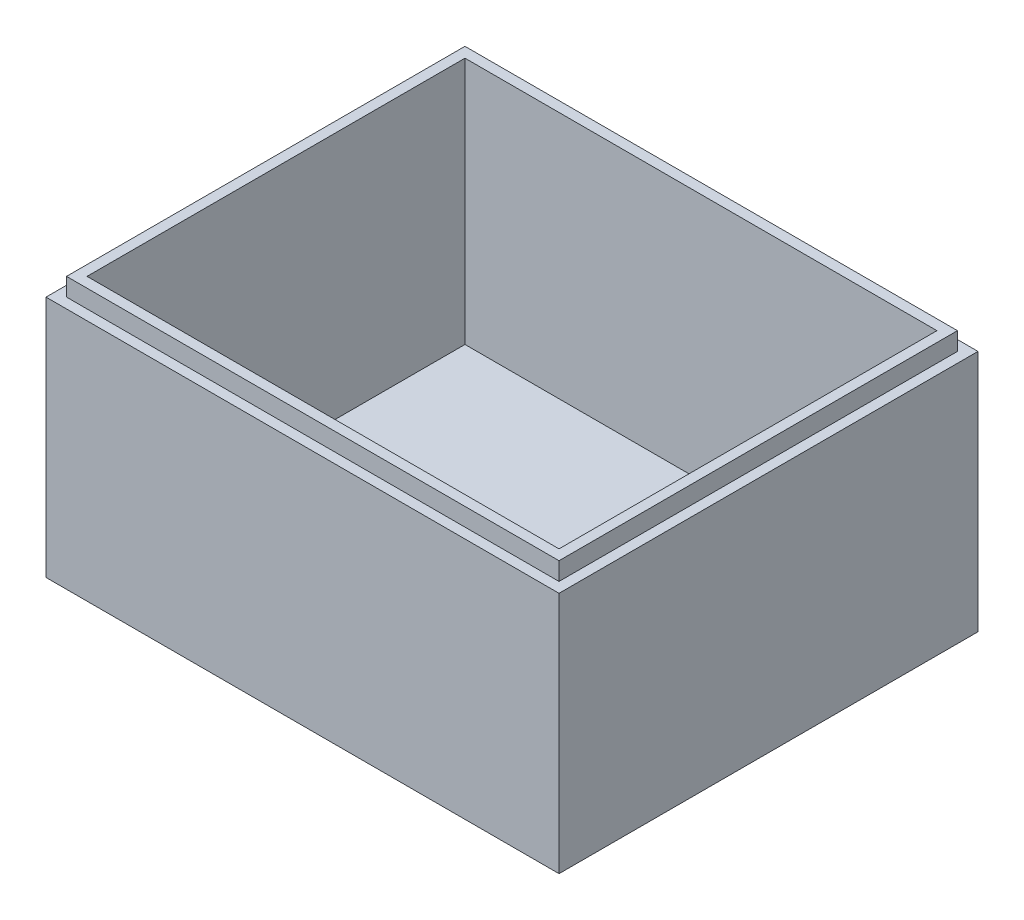
from build123d import *

# Parameters (mm, degrees)
BATTERYANDOUTERWALLS_W   = 60
BATTERYANDOUTERWALLS_H   = 49
BATTERYANDOUTERWALLS_W_2 = 55.2
BATTERYANDOUTERWALLS_H_2 = 44.2
WALLS_DEPTH              = 29
SKETCH2_W                = 60
SKETCH2_H                = 49
BOTTOM_DEPTH             = 1.5
SINKRIM_W                = 60
SINKRIM_H                = 49
SINKRIM_W_2              = 57.6
SINKRIM_H_2              = 46.6
TOP_CUT_DEPTH            = 2.1


with BuildPart() as part:
    # BatteryAndOuterWalls → Walls (new body)
    with BuildSketch(Plane(origin=(0, 0, 0), x_dir=(1, 0, 0), z_dir=(0, 1, 0))):
        Rectangle(BATTERYANDOUTERWALLS_W, BATTERYANDOUTERWALLS_H)
        Rectangle(BATTERYANDOUTERWALLS_W_2, BATTERYANDOUTERWALLS_H_2, mode=Mode.SUBTRACT)
    extrude(amount=WALLS_DEPTH)

    # Sketch2 → Bottom (add)
    with BuildSketch(Plane.XZ):
        Rectangle(SKETCH2_W, SKETCH2_H)
    extrude(amount=BOTTOM_DEPTH)

    # SinkRim → Top-Cut (cut)
    with BuildSketch(Plane(origin=(0, 29, 0), x_dir=(1, 0, 0), z_dir=(0, 1, 0))):
        Rectangle(SINKRIM_W, SINKRIM_H)
        Rectangle(SINKRIM_W_2, SINKRIM_H_2, mode=Mode.SUBTRACT)
    extrude(amount=-TOP_CUT_DEPTH, mode=Mode.SUBTRACT)


solid = part.part
